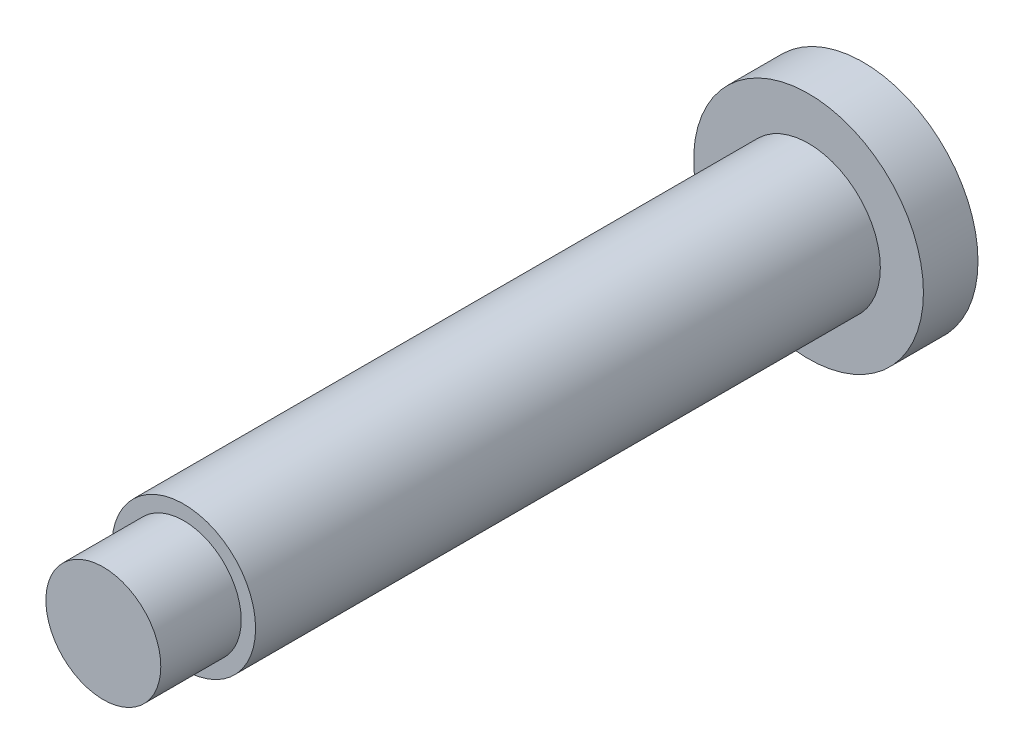
from build123d import *

# Parameters (mm, degrees)
SKETCH1_R           = 2.5
BOSS_EXTRUDE1_DEPTH = 21.75
SKETCH2_R           = 4
BOSS_EXTRUDE2_DEPTH = 1.9
SKETCH3_R           = 2.05
CUT_EXTRUDE1_DEPTH  = 3
SKETCH4_R           = 2
BOSS_EXTRUDE3_DEPTH = 2.8


with BuildPart() as part:
    # Sketch1 → Boss-Extrude1 (new body)
    with BuildSketch(Plane(origin=(0, 0, 0), x_dir=(0, 1, 0), z_dir=(0, 0, 1))):
        Circle(SKETCH1_R)
    extrude(amount=BOSS_EXTRUDE1_DEPTH)

    # Sketch2 → Boss-Extrude2 (add)
    with BuildSketch(Plane(origin=(0, 0, 0), x_dir=(1, 0, 0), z_dir=(0, 0, -1))):
        Circle(SKETCH2_R)
    extrude(amount=BOSS_EXTRUDE2_DEPTH)

    # Sketch3 → Cut-Extrude1 (cut)
    with BuildSketch(Plane(origin=(0, 0, -1.9), x_dir=(1, 0, 0), z_dir=(0, 0, -1))):
        Circle(SKETCH3_R)
    extrude(amount=-CUT_EXTRUDE1_DEPTH, mode=Mode.SUBTRACT)

    # Sketch4 → Boss-Extrude3 (add)
    with BuildSketch(Plane.XY.offset(21.75)):
        Circle(SKETCH4_R)
    extrude(amount=BOSS_EXTRUDE3_DEPTH)


solid = part.part
